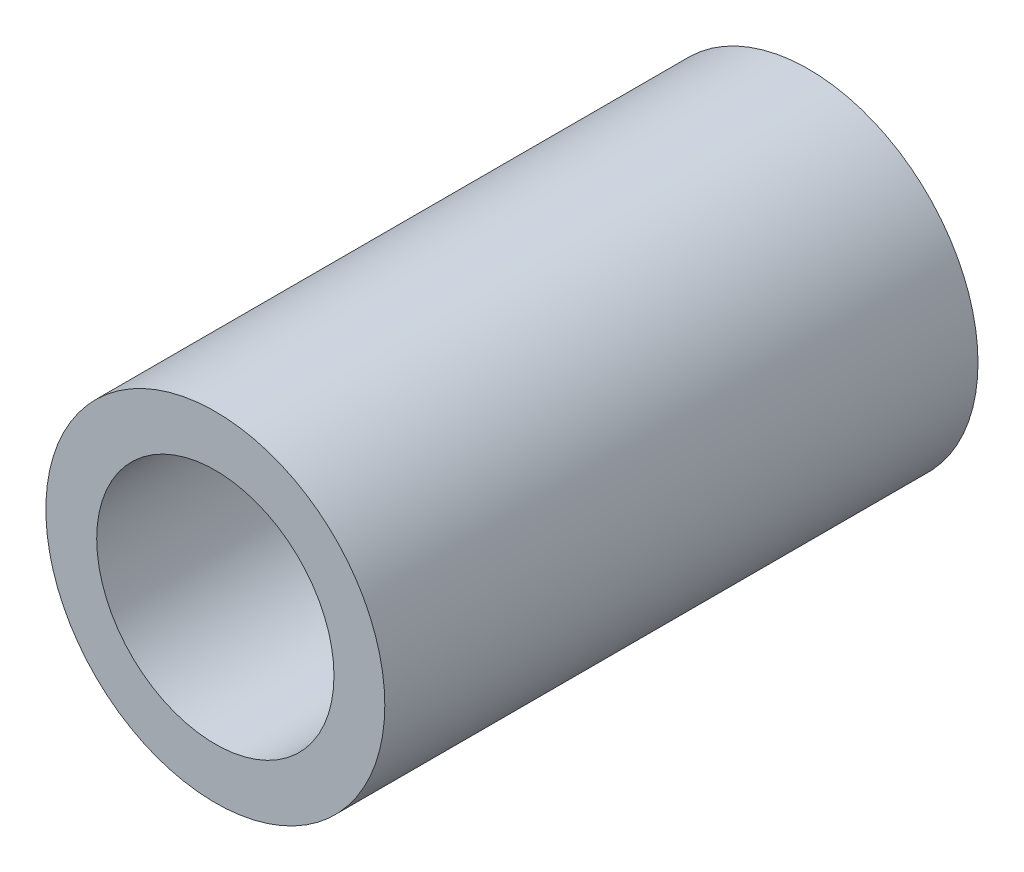
from build123d import *

# Parameters (mm, degrees)
SKETCH1_R           = 6.35
SKETCH1_R_2         = 4.445
BOSS_EXTRUDE1_DEPTH = 11.1125


with BuildPart() as part:
    # Sketch1 → Boss-Extrude1 (new, symmetric)
    with BuildSketch(Plane.XY):
        Circle(SKETCH1_R)
        Circle(SKETCH1_R_2, mode=Mode.SUBTRACT)
    extrude(amount=BOSS_EXTRUDE1_DEPTH, both=True)


solid = part.part
